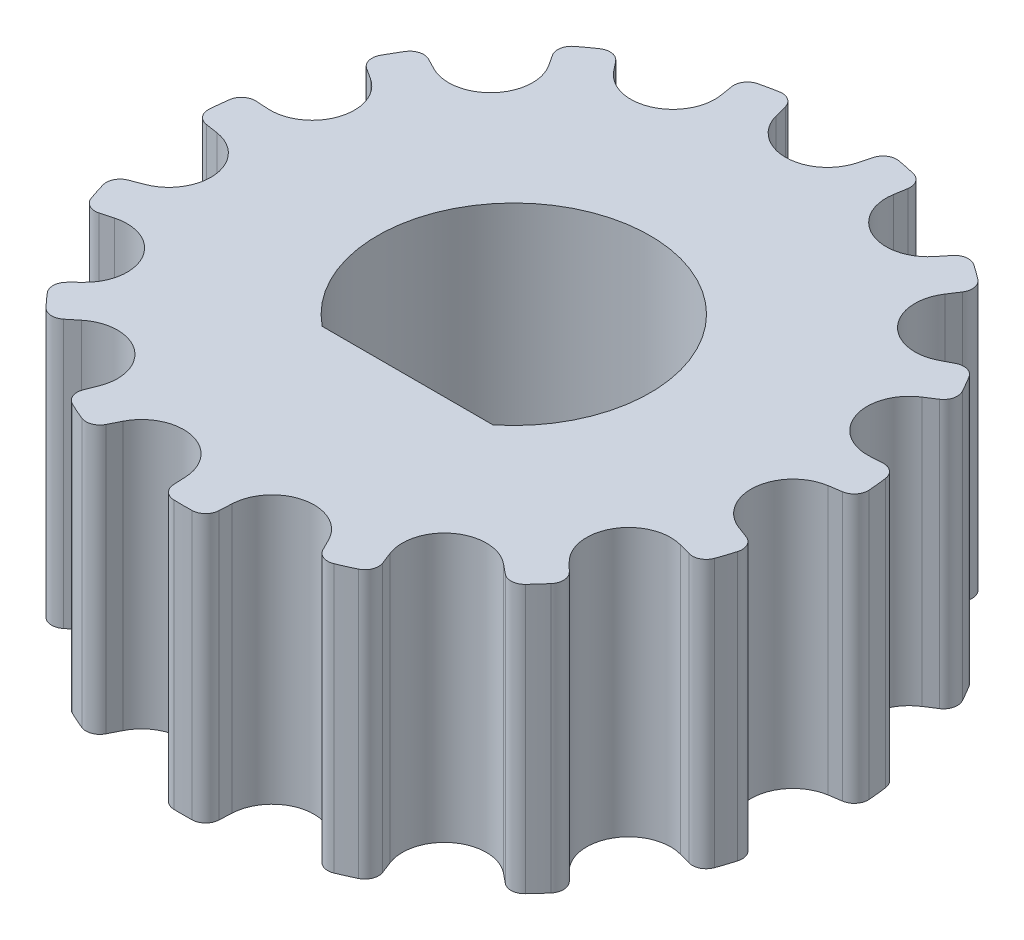
from build123d import *

# Parameters (mm, degrees)
SKETCH1_R           = 7.161972439
BOSS_EXTRUDE1_DEPTH = 5.8
CUT_EXTRUDE1_DEPTH  = 12.671662197
CIRPATTERN1_COUNT   = 15
CUT_EXTRUDE2_DEPTH  = 12.659198501


with BuildPart() as part:
    # Sketch1 → Boss-Extrude1 (new body)
    with BuildSketch(Plane(origin=(0, 0, 0), x_dir=(1, 0, 0), z_dir=(0, 1, 0))):
        Circle(SKETCH1_R)
    extrude(amount=BOSS_EXTRUDE1_DEPTH)

    # Sketch2 → Cut-Extrude1 (cut, through all)
    with BuildSketch(Plane(origin=(0, 5.8, 0), x_dir=(1, 0, 0), z_dir=(0, 1, 0))):
        with BuildLine():
            Line((-0.879885324, 6.559804793), (-0.95, 6.825530337))
            ThreePointArc((-0.95, 6.825530337), (-1.079308013, 7.002279754), (-1.294287054, 7.044052118))
            ThreePointArc((-1.294287054, 7.044052118), (-2.118539526, 6.841464719), (-2.913036628, 6.54278739))
            Line((-2.913036628, 6.54278739), (-2.913036628, 7.161972439))
            Line((-2.913036628, 7.161972439), (2.913036628, 7.161972439))
            Line((2.913036628, 7.161972439), (2.913036628, 6.54278739))
            ThreePointArc((2.913036628, 6.54278739), (2.118539526, 6.841464719), (1.294287054, 7.044052118))
            ThreePointArc((1.294287054, 7.044052118), (1.079308013, 7.002279754), (0.95, 6.825530337))
            Line((0.95, 6.825530337), (0.879885324, 6.559804793))
            ThreePointArc((0.879885324, 6.559804793), (0, 5.881972439), (-0.879885324, 6.559804793))
        make_face()
    cut_extrude1 = extrude(amount=-CUT_EXTRUDE1_DEPTH, mode=Mode.SUBTRACT)

    # CirPattern1: Cut-Extrude1 ×15 about axis
    cirpattern1_axis = Axis((0, 5.8, 0), (0, -1, 0))
    for i in range(1, CIRPATTERN1_COUNT):
        add(cut_extrude1.rotate(cirpattern1_axis, i * 360 / CIRPATTERN1_COUNT), mode=Mode.SUBTRACT)

    # Sketch3 → Cut-Extrude2 (cut, through all)
    with BuildSketch(Plane.XZ):
        with BuildLine():
            Line((1.84729532, 2.3), (-1.84729532, 2.3))
            ThreePointArc((-1.84729532, 2.3), (0, -2.95), (1.84729532, 2.3))
        make_face()
    extrude(amount=-CUT_EXTRUDE2_DEPTH, mode=Mode.SUBTRACT)


solid = part.part
